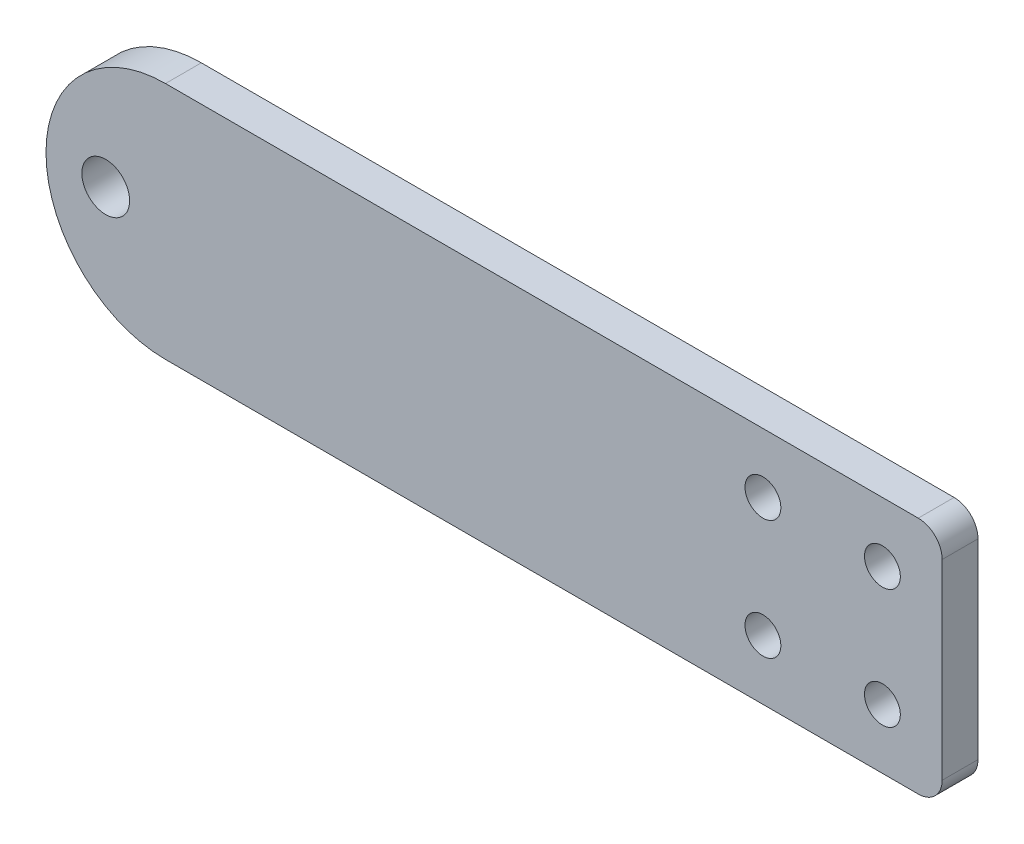
from build123d import *

# Parameters (mm, degrees)
SKETCH_1_W          = 75
SKETCH_1_H          = 20
EXTRUDE_1_DEPTH     = 3
SKETCH_2_R          = 1.5
SKETCH_2_R_2        = 2
CUT_EXTRUDE_1_DEPTH = 4
FILLET_1_R          = 10
FILLET_2_R          = 2


with BuildPart() as part:
    # 草图1 → 凸台-拉伸1 (new body)
    with BuildSketch(Plane.XY):
        with Locations((37.5, 10)):
            Rectangle(SKETCH_1_W, SKETCH_1_H)
    extrude(amount=EXTRUDE_1_DEPTH)

    # 草图2 → 切除-拉伸1 (cut)
    with BuildSketch(Plane.XY.offset(3)):
        with Locations((70, 15)):
            Circle(SKETCH_2_R)
        with Locations((70, 5)):
            Circle(SKETCH_2_R)
        with Locations((60, 15)):
            Circle(SKETCH_2_R)
        with Locations((60, 5)):
            Circle(SKETCH_2_R)
        with Locations((5, 10)):
            Circle(SKETCH_2_R_2)
    extrude(amount=-CUT_EXTRUDE_1_DEPTH, mode=Mode.SUBTRACT)

    # 圆角1
    fillet_1_edges = [part.edges().sort_by_distance(p)[0] for p in [
        (0, 0, 1.5),
        (0, 20, 1.5),
    ]]
    fillet(fillet_1_edges, radius=FILLET_1_R - 0.0001)  # a hair under: the kernel refuses the full size

    # 圆角2
    fillet_2_edges = [part.edges().sort_by_distance(p)[0] for p in [
        (75, 20, 1.5),
        (75, 0, 1.5),
    ]]
    fillet(fillet_2_edges, radius=FILLET_2_R)


solid = part.part
